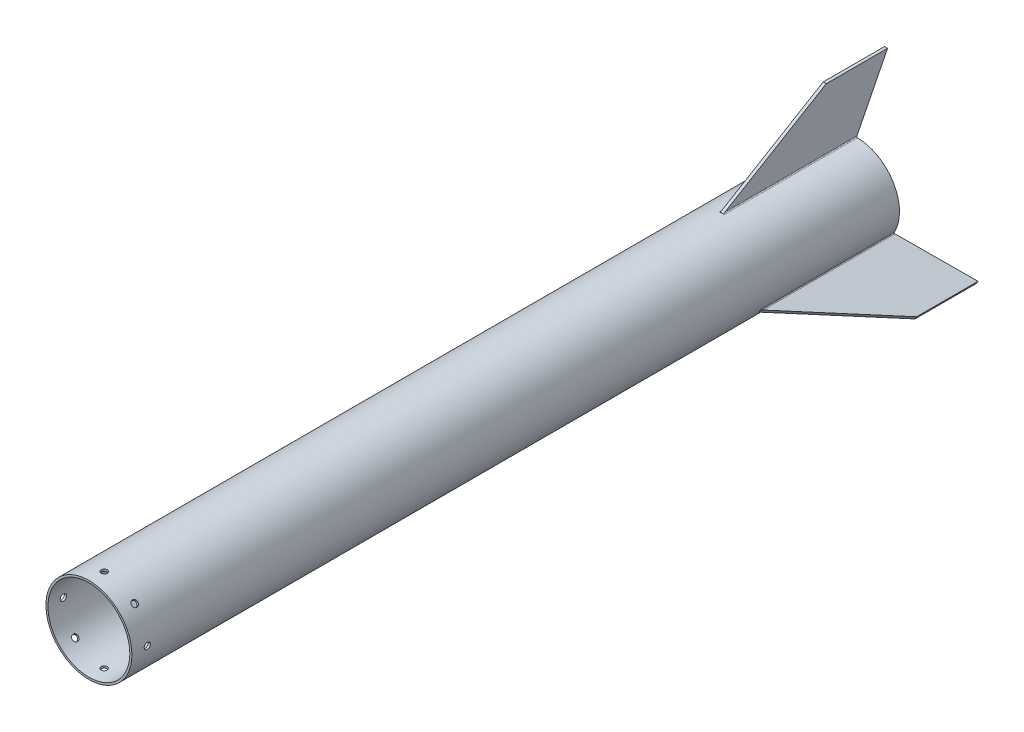
from build123d import *

# Parameters (mm, degrees)
SKETCH1_R               = 42
SKETCH1_R_2             = 40
BOSS_EXTRUDE1_DEPTH     = 750
CUT_EXTRUDE1_REACH      = 758.196
CUT_EXTRUDE1_END_RADIUS = 40
SKETCH2_R               = 3
CIRPATTERN1_COUNT       = 8
SKETCH4_R               = 5
CUT_EXTRUDE2_DEPTH      = 0.313731
CIRPATTERN2_COUNT       = 6
BOSS_EXTRUDE6_DEPTH     = 3
BOSS_EXTRUDE7_DEPTH     = 3
BOSS_EXTRUDE5_DEPTH     = 3
FILLET5_R               = 1


with BuildPart() as part:
    # Sketch1 → Boss-Extrude1 (new body)
    with BuildSketch(Plane.XY):
        Circle(SKETCH1_R)
        Circle(SKETCH1_R_2, mode=Mode.SUBTRACT)
    extrude(amount=BOSS_EXTRUDE1_DEPTH)

    # Cut-Extrude1: up to this cylinder (the profile starts outside it)
    cut_extrude1_end = Plane(origin=(0, 0, 735), z_dir=(0, 0, -1)) * Cylinder(CUT_EXTRUDE1_END_RADIUS, 1597.392, mode=Mode.PRIVATE)
    # Sketch2 → Cut-Extrude1 (cut, up to the surface)
    with BuildSketch(Plane(origin=(45, 0, 0), x_dir=(0, 0, -1), z_dir=(1, 0, 0)), mode=Mode.PRIVATE) as cut_extrude1_sk1:
        with Locations((-735, 0)):
            Circle(SKETCH2_R)
    cut_extrude1_tool1 = extrude(cut_extrude1_sk1.sketch, amount=-CUT_EXTRUDE1_REACH, mode=Mode.PRIVATE) - cut_extrude1_end
    cut_extrude1 = cut_extrude1_tool1.solids().sort_by_distance((45, 0, 735))[0]
    add(cut_extrude1, mode=Mode.SUBTRACT)

    # CirPattern1: Cut-Extrude1 ×8 about axis
    cirpattern1_axis = Axis((0, 0, 750), (0, 0, -1))
    for i in range(1, CIRPATTERN1_COUNT):
        add(cut_extrude1.rotate(cirpattern1_axis, i * 360 / CIRPATTERN1_COUNT), mode=Mode.SUBTRACT)

    # Sketch4 → Cut-Extrude2 (cut)
    with BuildSketch(Plane(origin=(-40, 0, 0), x_dir=(0, 0, -1), z_dir=(1, 0, 0))):
        with Locations((-20, 0)):
            Circle(SKETCH4_R)
    cut_extrude2 = extrude(amount=CUT_EXTRUDE2_DEPTH, mode=Mode.SUBTRACT)

    # CirPattern2: Cut-Extrude2 ×6 about axis
    cirpattern2_axis = Axis((0, 0, 0), (0, 0, 1))
    for i in range(1, CIRPATTERN2_COUNT):
        add(cut_extrude2.rotate(cirpattern2_axis, i * 360 / CIRPATTERN2_COUNT), mode=Mode.SUBTRACT)

    # Sketch13 → Boss-Extrude6 (add)
    with BuildSketch(Plane.ZY):
        Polygon((130, 42), (29.613250875, 102), (-30.386749125, 102), (0, 42), (0, 41), (130, 41), align=None)
    extrude(amount=BOSS_EXTRUDE6_DEPTH)

    # Sketch10 → Boss-Extrude7 (add)
    with BuildSketch(Plane(origin=(0, 0, 0), x_dir=(0, 0, 1), z_dir=(-0.49999999999999956, 0.866025403784439, 0))):
        Polygon((0, -42), (-30.386749125, -102), (29.613250875, -102), (130, -42), (130, -41), (0, -41), align=None)
    extrude(amount=BOSS_EXTRUDE7_DEPTH)

    # Sketch12 → Boss-Extrude5 (add)
    with BuildSketch(Plane(origin=(0, 0, 0), x_dir=(0, 0, 1), z_dir=(-0.5000000000000002, -0.8660254037844386, 0))):
        Polygon((130, -42), (29.613250875, -102), (-30.386749125, -102), (0, -42), (0, -41), (130, -41), align=None)
    extrude(amount=BOSS_EXTRUDE5_DEPTH)

    # Fillet5
    # the kernel refuses this fillet: 1 mm, written as the material it adds along each edge
    with BuildSketch(Plane(origin=(-3, 41.892720131, 130), x_dir=(-0.996613317913768, -0.08223073973223786, 0), z_dir=(0, 0, -1))) as fillet5_piece_1_section:
        with BuildLine():
            CenterArc((0.920892858, 0.99994131), FILLET5_R, 184.716800304, 84.662443151)
            Line((-0.07572046, 0.91771057), (0, 0))
            ThreePointArc((0, 0), (0.455029412, 0.002464974), (0.910058824, 0))
        make_face()
    fillet5_piece_1 = extrude(amount=130, mode=Mode.PRIVATE)
    fillet5_piece_1 = split(fillet5_piece_1, bisect_by=Plane(origin=(-3.203791951, 15.905493925, 13.215453494), z_dir=(0, 0.4518080104971197, 0.8921151952806513)), keep=Keep.TOP, mode=Mode.PRIVATE)
    fillet5_piece_1 = split(fillet5_piece_1, bisect_by=Plane(origin=(-3.203791951, 70.687657141, 82.00232266), z_dir=(0, -0.8583670503956391, -0.5130360677331476)), keep=Keep.TOP, mode=Mode.PRIVATE)
    add(fillet5_piece_1)
    with BuildSketch(Plane(origin=(-3, 41.892720131, 130), x_dir=(-0.996613317913768, -0.08223073973223786, 0), z_dir=(0, 0, -1))) as fillet5_piece_2_section:
        with BuildLine():
            CenterArc((0.920892858, 0.99994131), FILLET5_R, 184.716800304, 84.662443151)
            Line((-0.07572046, 0.91771057), (0, 0))
            ThreePointArc((0, 0), (0.455029412, 0.002464974), (0.910058824, 0))
        make_face()
    fillet5_piece_2 = extrude(amount=132.302072815, mode=Mode.PRIVATE)
    fillet5_piece_2 = split(fillet5_piece_2, bisect_by=Plane(origin=(-3.054565795, 42.373830486, 0), z_dir=(0, 0, -1)), keep=Keep.TOP, mode=Mode.PRIVATE)
    fillet5_piece_2 = split(fillet5_piece_2, bisect_by=Plane(origin=(-3.054565795, 42.335675388, -0.170001397), z_dir=(0, 0.4518080104971197, 0.8921151952806513)), keep=Keep.TOP, mode=Mode.PRIVATE)
    add(fillet5_piece_2)
    with BuildSketch(Plane(origin=(-3, 41.892720131, 130), x_dir=(-0.996613317913768, -0.08223073973223786, 0), z_dir=(0, 0, -1))) as fillet5_piece_3_section:
        with BuildLine():
            CenterArc((0.920892858, 0.99994131), FILLET5_R, 184.716800304, 84.662443151)
            Line((-0.07572046, 0.91771057), (0, 0))
            ThreePointArc((0, 0), (0.455029412, 0.002464974), (0.910058824, 0))
        make_face()
    fillet5_piece_3 = extrude(amount=130, mode=Mode.PRIVATE)
    fillet5_piece_3 = split(fillet5_piece_3, bisect_by=Plane(origin=(-3.40261904, 41.894428705, 0.053466141), z_dir=(0, -0.4518080104971197, -0.8921151952806513)), keep=Keep.TOP, mode=Mode.PRIVATE)
    add(fillet5_piece_3)
    with BuildSketch(Plane(origin=(0, 42, 132.470926301), x_dir=(0.9999323844606354, -0.011628693257112832, 0), z_dir=(0, 0, -1))) as fillet5_piece_4_section:
        with BuildLine():
            CenterArc((0.988438927, -0.999932384), FILLET5_R, 90.666290062, 88.667419876)
            Line((-0.011493458, -0.988303691), (0, 0))
            ThreePointArc((0, 0), (0.488405117, -0.002839853), (0.976810234, 0))
        make_face()
    fillet5_piece_4 = extrude(amount=132.470926301, mode=Mode.PRIVATE)
    fillet5_piece_4 = split(fillet5_piece_4, bisect_by=Plane(origin=(0.558878228, 41.983371629, 130), z_dir=(0, 0, 1)), keep=Keep.TOP, mode=Mode.PRIVATE)
    fillet5_piece_4 = split(fillet5_piece_4, bisect_by=Plane(origin=(0.558878228, 41.989497471, 130.017571912), z_dir=(0, -0.8583670503956391, -0.5130360677331476)), keep=Keep.TOP, mode=Mode.PRIVATE)
    add(fillet5_piece_4)
    with BuildSketch(Plane(origin=(0, 42, 130), x_dir=(0.9999323844606354, -0.0116286932571128, 0), z_dir=(0, 0, -1))) as fillet5_piece_5_section:
        with BuildLine():
            CenterArc((0.988438927, -0.999932384), FILLET5_R, 90.666290062, 88.667419876)
            Line((-0.011493458, -0.988303691), (0, 0))
            ThreePointArc((0, 0), (0.488405117, -0.002839853), (0.976810234, 0))
        make_face()
    fillet5_piece_5 = extrude(amount=130, mode=Mode.PRIVATE)
    fillet5_piece_5 = split(fillet5_piece_5, bisect_by=Plane(origin=(0.221220494, 70.765119617, 81.872719224), z_dir=(0, -0.8583670503956391, -0.5130360677331476)), keep=Keep.TOP, mode=Mode.PRIVATE)
    add(fillet5_piece_5)
    with BuildSketch(Plane(origin=(0, 42, 130), x_dir=(0.9999323844606354, -0.0116286932571128, 0), z_dir=(0, 0, -1))) as fillet5_piece_6_section:
        with BuildLine():
            CenterArc((0.988438927, -0.999932384), FILLET5_R, 90.666290062, 88.667419876)
            Line((-0.011493458, -0.988303691), (0, 0))
            ThreePointArc((0, 0), (0.488405117, -0.002839853), (0.976810234, 0))
        make_face()
    fillet5_piece_6 = extrude(amount=132.470926301, mode=Mode.PRIVATE)
    fillet5_piece_6 = split(fillet5_piece_6, bisect_by=Plane(origin=(0.102078844, 42.427040524, 0), z_dir=(0, 0, -1)), keep=Keep.TOP, mode=Mode.PRIVATE)
    fillet5_piece_6 = split(fillet5_piece_6, bisect_by=Plane(origin=(0.102078844, 42.383454531, -0.194198944), z_dir=(0, 0.4518080104971197, 0.8921151952806513)), keep=Keep.TOP, mode=Mode.PRIVATE)
    add(fillet5_piece_6)
    with BuildSketch(Plane(origin=(0, 42, 130), x_dir=(0.9999323844606354, -0.0116286932571128, 0), z_dir=(0, 0, -1))) as fillet5_piece_7_section:
        with BuildLine():
            CenterArc((0.988438927, -0.999932384), FILLET5_R, 90.666290062, 88.667419876)
            Line((-0.011493458, -0.988303691), (0, 0))
            ThreePointArc((0, 0), (0.488405117, -0.002839853), (0.976810234, 0))
        make_face()
    fillet5_piece_7 = extrude(amount=130, mode=Mode.PRIVATE)
    fillet5_piece_7 = split(fillet5_piece_7, bisect_by=Plane(origin=(0.558878228, 41.985068808, 0.00756184), z_dir=(0, -0.4518080104971197, -0.8921151952806513)), keep=Keep.TOP, mode=Mode.PRIVATE)
    add(fillet5_piece_7)
    with BuildSketch(Plane(origin=(-36.373066959, -21, 132.470926301), x_dir=(0.5100369360037914, -0.8601525003811035, 0), z_dir=(0, 0, -1))) as fillet5_piece_8_section:
        with BuildLine():
            CenterArc((0.988438927, 0.999932384), FILLET5_R, 180.666290062, 88.667419876)
            Line((-0.011493458, 0.988303691), (0, 0))
            ThreePointArc((0, 0), (0.488405117, 0.002839853), (0.976810234, 0))
        make_face()
    fillet5_piece_8 = extrude(amount=132.470926301, mode=Mode.PRIVATE)
    fillet5_piece_8 = split(fillet5_piece_8, bisect_by=Plane(origin=(-36.079227253, -21.475688557, 130), z_dir=(0, 0, 1)), keep=Keep.TOP, mode=Mode.PRIVATE)
    fillet5_piece_8 = split(fillet5_piece_8, bisect_by=Plane(origin=(-36.084532388, -21.478751479, 130.017571912), z_dir=(0.7433676714141411, 0.42918352519781916, -0.5130360677331475)), keep=Keep.TOP, mode=Mode.PRIVATE)
    add(fillet5_piece_8)
    with BuildSketch(Plane(origin=(-36.373066959, -21, 130), x_dir=(0.5100369360037946, -0.8601525003811016, 0), z_dir=(0, 0, -1))) as fillet5_piece_9_section:
        with BuildLine():
            CenterArc((0.988438927, 0.999932384), FILLET5_R, 180.666290062, 88.667419876)
            Line((-0.011493458, 0.988303691), (0, 0))
            ThreePointArc((0, 0), (0.488405117, 0.002839853), (0.976810234, 0))
        make_face()
    fillet5_piece_9 = extrude(amount=130, mode=Mode.PRIVATE)
    fillet5_piece_9 = split(fillet5_piece_9, bisect_by=Plane(origin=(-61.173781043, -35.574142376, 81.872719224), z_dir=(0.7433676714141411, 0.42918352519781916, -0.5130360677331475)), keep=Keep.TOP, mode=Mode.PRIVATE)
    add(fillet5_piece_9)
    with BuildSketch(Plane(origin=(-36.373066959, -21, 130), x_dir=(0.5100369360037946, -0.8601525003811016, 0), z_dir=(0, 0, -1))) as fillet5_piece_10_section:
        with BuildLine():
            CenterArc((0.988438927, 0.999932384), FILLET5_R, 180.666290062, 88.667419876)
            Line((-0.011493458, 0.988303691), (0, 0))
            ThreePointArc((0, 0), (0.488405117, 0.002839853), (0.976810234, 0))
        make_face()
    fillet5_piece_10 = extrude(amount=132.470926301, mode=Mode.PRIVATE)
    fillet5_piece_10 = split(fillet5_piece_10, bisect_by=Plane(origin=(-36.69185548, -21.301923134, 0), z_dir=(0, 0, -1)), keep=Keep.TOP, mode=Mode.PRIVATE)
    fillet5_piece_10 = split(fillet5_piece_10, bisect_by=Plane(origin=(-36.654108902, -21.280130137, -0.194198944), z_dir=(-0.39127721472381205, -0.22590400524855966, 0.8921151952806514)), keep=Keep.TOP, mode=Mode.PRIVATE)
    add(fillet5_piece_10)
    with BuildSketch(Plane(origin=(-36.373066959, -21, 130), x_dir=(0.5100369360037946, -0.8601525003811016, 0), z_dir=(0, 0, -1))) as fillet5_piece_11_section:
        with BuildLine():
            CenterArc((0.988438927, 0.999932384), FILLET5_R, 180.666290062, 88.667419876)
            Line((-0.011493458, 0.988303691), (0, 0))
            ThreePointArc((0, 0), (0.488405117, 0.002839853), (0.976810234, 0))
        make_face()
    fillet5_piece_11 = extrude(amount=130, mode=Mode.PRIVATE)
    fillet5_piece_11 = split(fillet5_piece_11, bisect_by=Plane(origin=(-36.080697053, -21.476537147, 0.00756184), z_dir=(0.39127721472381205, 0.22590400524855966, -0.8921151952806514)), keep=Keep.TOP, mode=Mode.PRIVATE)
    add(fillet5_piece_11)
    with BuildSketch(Plane(origin=(-37.780159867, -18.348283854, 130), x_dir=(-0.4270927493767757, 0.9042078209293407, 0), z_dir=(0, 0, -1))) as fillet5_piece_12_section:
        with BuildLine():
            CenterArc((0.920892858, -0.99994131), FILLET5_R, 90.620756546, 84.662443151)
            Line((-0.07572046, -0.91771057), (0, 0))
            ThreePointArc((0, 0), (0.455029412, -0.002464974), (0.910058824, 0))
        make_face()
    fillet5_piece_12 = extrude(amount=130, mode=Mode.PRIVATE)
    fillet5_piece_12 = split(fillet5_piece_12, bisect_by=Plane(origin=(-62.819202793, -32.569263353, 82.00232266), z_dir=(0.7433676714141411, 0.42918352519781916, -0.5130360677331475)), keep=Keep.TOP, mode=Mode.PRIVATE)
    fillet5_piece_12 = split(fillet5_piece_12, bisect_by=Plane(origin=(-15.376457774, -5.178181745, 13.215453494), z_dir=(-0.39127721472381205, -0.22590400524855966, 0.8921151952806514)), keep=Keep.TOP, mode=Mode.PRIVATE)
    add(fillet5_piece_12)
    with BuildSketch(Plane(origin=(-37.780159867, -18.348283854, 130), x_dir=(-0.4270927493767757, 0.9042078209293407, 0), z_dir=(0, 0, -1))) as fillet5_piece_13_section:
        with BuildLine():
            CenterArc((0.920892858, -0.99994131), FILLET5_R, 90.620756546, 84.662443151)
            Line((-0.07572046, -0.91771057), (0, 0))
            ThreePointArc((0, 0), (0.455029412, -0.002464974), (0.910058824, 0))
        make_face()
    fillet5_piece_13 = extrude(amount=132.302072815, mode=Mode.PRIVATE)
    fillet5_piece_13 = split(fillet5_piece_13, bisect_by=Plane(origin=(-38.224096554, -18.541583667, 0), z_dir=(0, 0, -1)), keep=Keep.TOP, mode=Mode.PRIVATE)
    fillet5_piece_13 = split(fillet5_piece_13, bisect_by=Plane(origin=(-38.19105327, -18.522506118, -0.170001397), z_dir=(-0.39127721472381205, -0.22590400524855966, 0.8921151952806514)), keep=Keep.TOP, mode=Mode.PRIVATE)
    add(fillet5_piece_13)
    with BuildSketch(Plane(origin=(-37.780159867, -18.348283854, 130), x_dir=(-0.4270927493767757, 0.9042078209293407, 0), z_dir=(0, 0, -1))) as fillet5_piece_14_section:
        with BuildLine():
            CenterArc((0.920892858, -0.99994131), FILLET5_R, 90.620756546, 84.662443151)
            Line((-0.07572046, -0.91771057), (0, 0))
            ThreePointArc((0, 0), (0.455029412, -0.002464974), (0.910058824, 0))
        make_face()
    fillet5_piece_14 = extrude(amount=130, mode=Mode.PRIVATE)
    fillet5_piece_14 = split(fillet5_piece_14, bisect_by=Plane(origin=(-37.982949055, -18.000459824, 0.053466141), z_dir=(0.39127721472381205, 0.22590400524855966, -0.8921151952806514)), keep=Keep.TOP, mode=Mode.PRIVATE)
    add(fillet5_piece_14)
    with BuildSketch(Plane(origin=(36.373066959, -21, 132.470926301), x_dir=(0.48989544845683597, 0.8717811936382177, 0), z_dir=(0, 0, -1))) as fillet5_piece_15_section:
        with BuildLine():
            CenterArc((0.988438927, 0.999932384), FILLET5_R, 180.666290062, 88.667419876)
            Line((-0.011493458, 0.988303691), (0, 0))
            ThreePointArc((0, 0), (0.488405117, 0.002839853), (0.976810234, 0))
        make_face()
    fillet5_piece_15 = extrude(amount=132.470926301, mode=Mode.PRIVATE)
    fillet5_piece_15 = split(fillet5_piece_15, bisect_by=Plane(origin=(36.638105481, -20.507683071, 130), z_dir=(0, 0, 1)), keep=Keep.TOP, mode=Mode.PRIVATE)
    fillet5_piece_15 = split(fillet5_piece_15, bisect_by=Plane(origin=(36.643410616, -20.510745993, 130.017571912), z_dir=(-0.7433676714141408, 0.4291835251978194, -0.5130360677331475)), keep=Keep.TOP, mode=Mode.PRIVATE)
    add(fillet5_piece_15)
    with BuildSketch(Plane(origin=(36.373066959, -21, 130), x_dir=(0.48989544845683325, 0.8717811936382192, 0), z_dir=(0, 0, -1))) as fillet5_piece_16_section:
        with BuildLine():
            CenterArc((0.988438927, 0.999932384), FILLET5_R, 180.666290062, 88.667419876)
            Line((-0.011493458, 0.988303691), (0, 0))
            ThreePointArc((0, 0), (0.488405117, 0.002839853), (0.976810234, 0))
        make_face()
    fillet5_piece_16 = extrude(amount=130, mode=Mode.PRIVATE)
    fillet5_piece_16 = split(fillet5_piece_16, bisect_by=Plane(origin=(61.395001537, -35.190977241, 81.872719224), z_dir=(-0.7433676714141408, 0.4291835251978194, -0.5130360677331475)), keep=Keep.TOP, mode=Mode.PRIVATE)
    add(fillet5_piece_16)
    with BuildSketch(Plane(origin=(36.373066959, -21, 130), x_dir=(0.48989544845683325, 0.8717811936382192, 0), z_dir=(0, 0, -1))) as fillet5_piece_17_section:
        with BuildLine():
            CenterArc((0.988438927, 0.999932384), FILLET5_R, 180.666290062, 88.667419876)
            Line((-0.011493458, 0.988303691), (0, 0))
            ThreePointArc((0, 0), (0.488405117, 0.002839853), (0.976810234, 0))
        make_face()
    fillet5_piece_17 = extrude(amount=132.470926301, mode=Mode.PRIVATE)
    fillet5_piece_17 = split(fillet5_piece_17, bisect_by=Plane(origin=(36.793934323, -21.12511739, 0), z_dir=(0, 0, -1)), keep=Keep.TOP, mode=Mode.PRIVATE)
    fillet5_piece_17 = split(fillet5_piece_17, bisect_by=Plane(origin=(36.756187746, -21.103324394, -0.194198944), z_dir=(0.39127721472381155, -0.22590400524855925, 0.8921151952806518)), keep=Keep.TOP, mode=Mode.PRIVATE)
    add(fillet5_piece_17)
    with BuildSketch(Plane(origin=(36.373066959, -21, 130), x_dir=(0.48989544845683325, 0.8717811936382192, 0), z_dir=(0, 0, -1))) as fillet5_piece_18_section:
        with BuildLine():
            CenterArc((0.988438927, 0.999932384), FILLET5_R, 180.666290062, 88.667419876)
            Line((-0.011493458, 0.988303691), (0, 0))
            ThreePointArc((0, 0), (0.488405117, 0.002839853), (0.976810234, 0))
        make_face()
    fillet5_piece_18 = extrude(amount=130, mode=Mode.PRIVATE)
    fillet5_piece_18 = split(fillet5_piece_18, bisect_by=Plane(origin=(36.639575281, -20.508531661, 0.00756184), z_dir=(-0.39127721472381155, 0.22590400524855925, -0.8921151952806518)), keep=Keep.TOP, mode=Mode.PRIVATE)
    add(fillet5_piece_18)
    with BuildSketch(Plane(origin=(34.780159867, -23.544436277, 130), x_dir=(-0.5695205685369891, -0.8219770811971003, 0), z_dir=(0, 0, -1))) as fillet5_piece_19_section:
        with BuildLine():
            CenterArc((0.920892858, -0.99994131), FILLET5_R, 90.620756546, 84.662443151)
            Line((-0.07572046, -0.91771057), (0, 0))
            ThreePointArc((0, 0), (0.455029412, -0.002464974), (0.910058824, 0))
        make_face()
    fillet5_piece_19 = extrude(amount=130, mode=Mode.PRIVATE)
    fillet5_piece_19 = split(fillet5_piece_19, bisect_by=Plane(origin=(12.172665823, -10.72731218, 13.215453494), z_dir=(0.39127721472381155, -0.22590400524855925, 0.8921151952806518)), keep=Keep.TOP, mode=Mode.PRIVATE)
    fillet5_piece_19 = split(fillet5_piece_19, bisect_by=Plane(origin=(59.615410843, -38.118393788, 82.00232266), z_dir=(-0.7433676714141408, 0.4291835251978194, -0.5130360677331475)), keep=Keep.TOP, mode=Mode.PRIVATE)
    add(fillet5_piece_19)
    with BuildSketch(Plane(origin=(34.780159867, -23.544436277, 130), x_dir=(-0.5695205685369891, -0.8219770811971003, 0), z_dir=(0, 0, -1))) as fillet5_piece_20_section:
        with BuildLine():
            CenterArc((0.920892858, -0.99994131), FILLET5_R, 90.620756546, 84.662443151)
            Line((-0.07572046, -0.91771057), (0, 0))
            ThreePointArc((0, 0), (0.455029412, -0.002464974), (0.910058824, 0))
        make_face()
    fillet5_piece_20 = extrude(amount=132.302072815, mode=Mode.PRIVATE)
    fillet5_piece_20 = split(fillet5_piece_20, bisect_by=Plane(origin=(35.169530759, -23.832246819, 0), z_dir=(0, 0, -1)), keep=Keep.TOP, mode=Mode.PRIVATE)
    fillet5_piece_20 = split(fillet5_piece_20, bisect_by=Plane(origin=(35.136487475, -23.81316927, -0.170001397), z_dir=(0.39127721472381155, -0.22590400524855925, 0.8921151952806518)), keep=Keep.TOP, mode=Mode.PRIVATE)
    add(fillet5_piece_20)
    with BuildSketch(Plane(origin=(34.780159867, -23.544436277, 130), x_dir=(-0.5695205685369891, -0.8219770811971003, 0), z_dir=(0, 0, -1))) as fillet5_piece_21_section:
        with BuildLine():
            CenterArc((0.920892858, -0.99994131), FILLET5_R, 90.620756546, 84.662443151)
            Line((-0.07572046, -0.91771057), (0, 0))
            ThreePointArc((0, 0), (0.455029412, -0.002464974), (0.910058824, 0))
        make_face()
    fillet5_piece_21 = extrude(amount=130, mode=Mode.PRIVATE)
    fillet5_piece_21 = split(fillet5_piece_21, bisect_by=Plane(origin=(34.580330015, -23.89396888, 0.053466141), z_dir=(-0.39127721472381155, 0.22590400524855925, -0.8921151952806518)), keep=Keep.TOP, mode=Mode.PRIVATE)
    add(fillet5_piece_21)


solid = part.part
